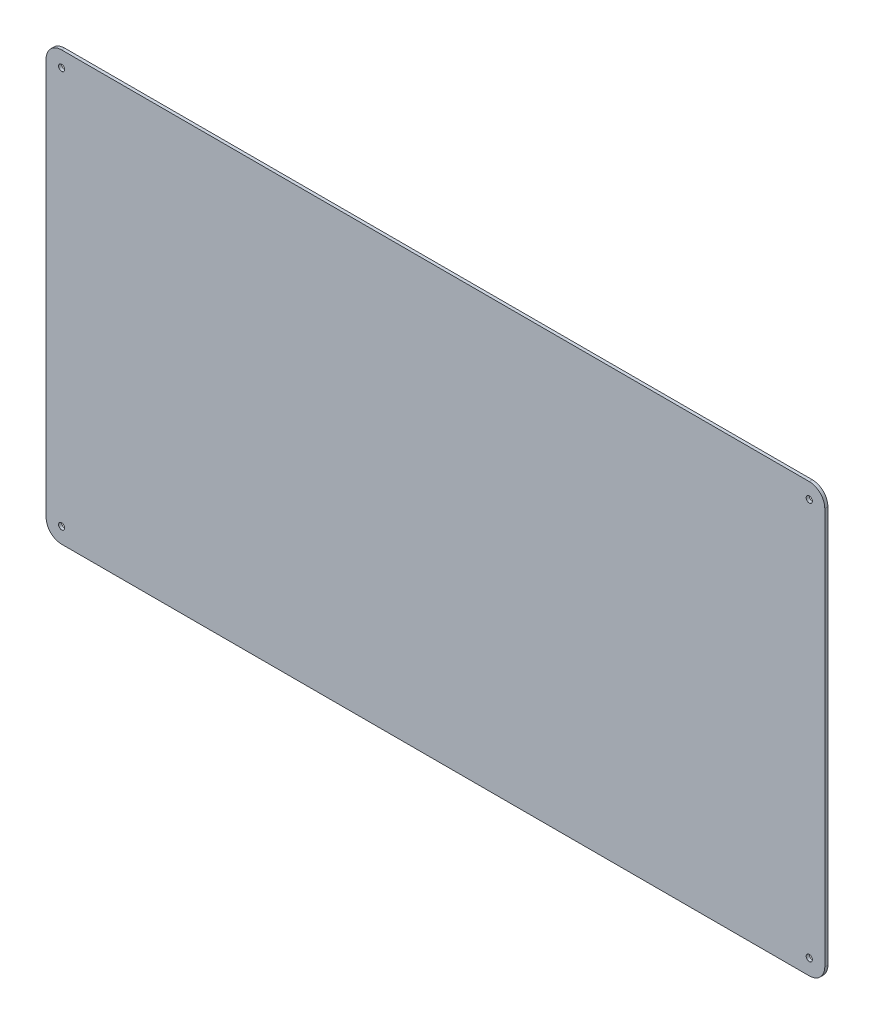
from build123d import *

# Parameters (mm, degrees)
SKETCH1_R          = 1
BASE_FLANGE1_DEPTH = 1


# Sheet-metal steps are written as plain solids
with BuildPart() as part:
    # Sketch1 → Base-Flange1 (new body)
    with BuildSketch(Plane.XY):
        with BuildLine():
            Line((5, 0), (246, 0))
            ThreePointArc((246, 0), (249.535533906, 1.464466094), (251, 5))
            Line((251, 5), (251, 133))
            ThreePointArc((251, 133), (249.535533906, 136.535533906), (246, 138))
            Line((246, 138), (5, 138))
            ThreePointArc((5, 138), (1.464466094, 136.535533906), (0, 133))
            Line((0, 133), (0, 5))
            ThreePointArc((0, 5), (1.464466094, 1.464466094), (5, 0))
        make_face()
        with Locations((5, 133)):
            Circle(SKETCH1_R, mode=Mode.SUBTRACT)
        with Locations((5, 5)):
            Circle(SKETCH1_R, mode=Mode.SUBTRACT)
        with Locations((246, 133)):
            Circle(SKETCH1_R, mode=Mode.SUBTRACT)
        with Locations((246, 5)):
            Circle(SKETCH1_R, mode=Mode.SUBTRACT)
    extrude(amount=-BASE_FLANGE1_DEPTH)


solid = part.part
